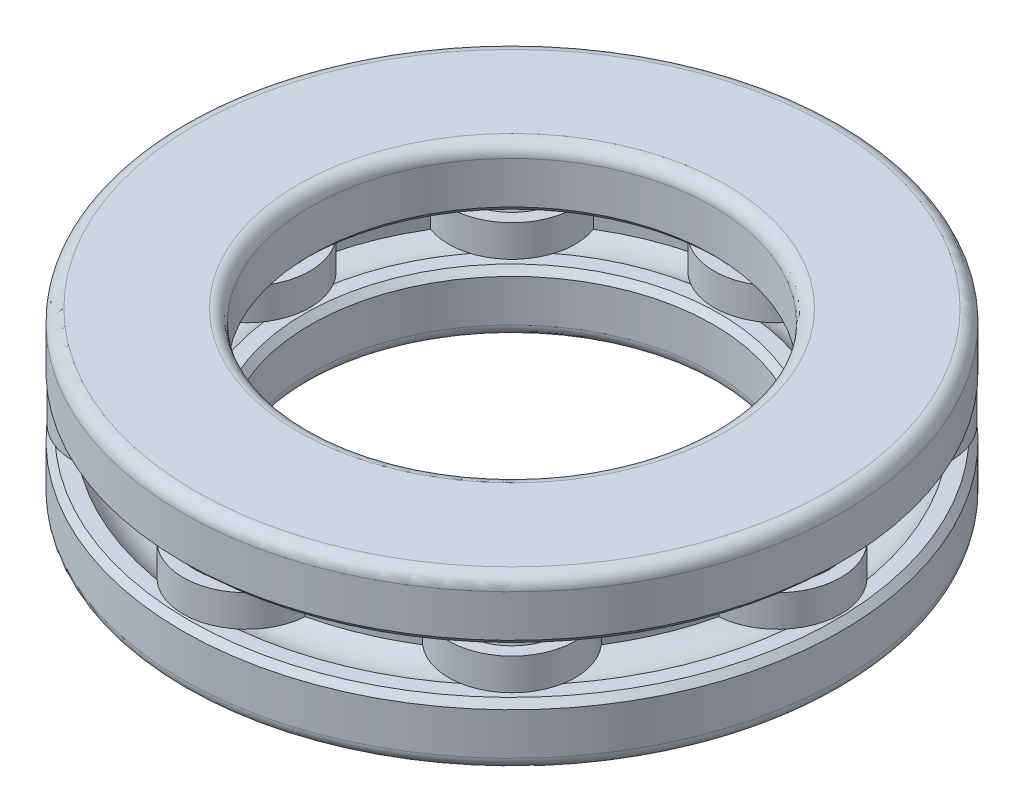
from build123d import *

# Parameters (mm, degrees)
CIRPATTERN2_COUNT       = 8
FILLET1_R               = 0.6
CHAMFER1_SIZE           = 0.6
FILLET2_R               = 0.6
CHAMFER2_SIZE           = 0.6
BOSS_EXTRUDE1_START     = -1
BOSS_EXTRUDE1_OUTLINE_R = 3.2
BOSS_EXTRUDE1_DEPTH     = 2
CUT_EXTRUDE1_DEPTH      = 31.20347676
CUT_EXTRUDE1_DEPTH_BACK = 31.20347676
SKETCH5_W               = 57.274889508
SKETCH5_H               = 8.854768194
SKETCH5_W_2             = 54.393576048
SKETCH5_H_2             = 6.043730672
SKETCH6_R               = 25.060722521
SKETCH6_R_2             = 20.796862697
SKETCH6_R_3             = 12.703137303
CUT_EXTRUDE2_DEPTH      = 32.56722991
FILLET3_R               = 0.8
FILLET4_R               = 0.8
FILLET5_R               = 0.8
FILLET6_R               = 0.8


# Read off the part's stored shape, not the designer's step: Boss-Extrude1
with BuildPart() as part:
    # Sketch1 → Revolve4 (revolve)
    with BuildSketch(Plane(origin=(0, 0, 0), x_dir=(0, 0, -1), z_dir=(1, 0, 0))):
        with BuildLine():
            Line((-16.75, 3), (-16.75, -3))
            ThreePointArc((-16.75, -3), (-19.75, 0), (-16.75, 3))
        make_face()
    revolve(axis=Axis((0, 0, 16.75), (0, 1, 0)))


with BuildPart() as body_2:
    # Sketch3 → Revolve5 (revolve)
    with BuildSketch(Plane(origin=(0, 0, 0), x_dir=(0, 0, -1), z_dir=(1, 0, 0)), mode=Mode.PRIVATE) as revolve5_sk:
        with BuildLine():
            Line((-12.5, 5.5), (-21, 5.5))
            Line((-21, 5.5), (-21, 1.5))
            Line((-21, 1.5), (-19.462931993, 1.5))
            ThreePointArc((-19.462931993, 1.5), (-16.75, 3.1), (-14.037068007, 1.5))
            Line((-14.037068007, 1.5), (-12.5, 1.5))
            Line((-12.5, 1.5), (-12.5, 5.5))
        make_face()
        with BuildLine():
            ThreePointArc((-14.037068007, -1.5), (-16.75, -3.1), (-19.462931993, -1.5))
            Line((-19.462931993, -1.5), (-21, -1.5))
            Line((-21, -1.5), (-21, -5.5))
            Line((-21, -5.5), (-12.5, -5.5))
            Line((-12.5, -5.5), (-12.5, -1.5))
            Line((-12.5, -1.5), (-14.037068007, -1.5))
        make_face()
    revolve(revolve5_sk.sketch.rotate(Axis((0, 0, 0), (0, 1, 0)), 180), axis=Axis((0, 0, 0), (0, 1, 0)))

    # Fillet1
    fillet1_edges = [body_2.edges().sort_by_distance(p)[0] for p in [
        (0, 5.5, 21),
        (0, 5.5, 12.5),
    ]]
    fillet(fillet1_edges, radius=FILLET1_R)

    # Chamfer1
    chamfer1_edges = [body_2.edges().sort_by_distance(p)[0] for p in [
        (0, -1.5, 12.5),
        (0, -1.5, 21),
    ]]
    chamfer(chamfer1_edges, length=CHAMFER1_SIZE)

    # Fillet2
    fillet2_edges = [body_2.edges().sort_by_distance(p)[0] for p in [
        (0, -5.5, 12.5),
        (0, -5.5, 21),
    ]]
    fillet(fillet2_edges, radius=FILLET2_R)

    # Chamfer2
    chamfer2_edges = [body_2.edges().sort_by_distance(p)[0] for p in [
        (0, 1.5, 21),
        (0, 1.5, 12.5),
    ]]
    chamfer(chamfer2_edges, length=CHAMFER2_SIZE)

    # Sketch5 → Cut-Extrude1 (cut, two sides: drawn at the far end of the back side and taken through both)
    with BuildSketch(Plane(origin=(0, 0, 0), x_dir=(0, 0, -1), z_dir=(1, 0, 0)).offset(-CUT_EXTRUDE1_DEPTH_BACK)):
        with Locations((2.600209708, 9.777384097)):
            Rectangle(SKETCH5_W, SKETCH5_H)
        with Locations((2.038002203, -8.371865336)):
            Rectangle(SKETCH5_W_2, SKETCH5_H_2)
    extrude(amount=CUT_EXTRUDE1_DEPTH + CUT_EXTRUDE1_DEPTH_BACK, mode=Mode.SUBTRACT)

    # Sketch6 → Cut-Extrude2 (cut, through all)
    # profile 1 of 2: a face of its own
    with BuildSketch(Plane(origin=(0, 5.35, 0), x_dir=(1, 0, 0), z_dir=(0, 1, 0))):
        Circle(SKETCH6_R)
        with Locations(Location((0, 0, 0), (0, 0, 270))):
            Circle(SKETCH6_R_2, mode=Mode.SUBTRACT)
    # profile 2 of 2: a face of its own
    with BuildSketch(Plane(origin=(0, 5.35, 0), x_dir=(1, 0, 0), z_dir=(0, 1, 0))):
        with Locations(Location((0, 0, 0), (0, 0, 270))):
            Circle(SKETCH6_R_3)
    extrude(amount=-CUT_EXTRUDE2_DEPTH, mode=Mode.SUBTRACT)

    # Fillet3
    fillet3_edges = [body_2.edges().sort_by_distance(p)[0] for p in [
        (0, 5.35, -20.796862697),
    ]]
    fillet(fillet3_edges, radius=FILLET3_R)

    # Fillet4
    fillet4_edges = [body_2.edges().sort_by_distance(p)[0] for p in [
        (0, -5.35, -20.796862697),
    ]]
    fillet(fillet4_edges, radius=FILLET4_R)

    # Fillet5
    fillet5_edges = [body_2.edges().sort_by_distance(p)[0] for p in [
        (0, 5.35, -12.703137303),
    ]]
    fillet(fillet5_edges, radius=FILLET5_R)

    # Fillet6
    fillet6_edges = [body_2.edges().sort_by_distance(p)[0] for p in [
        (0, -5.35, -12.703137303),
    ]]
    fillet(fillet6_edges, radius=FILLET6_R)


with BuildPart() as cirpattern2_1:
    # CirPattern2: pattern copy
    add(part.part.rotate(Axis((0, 0, 0), (0, 1, 0)), 1 * 360 / CIRPATTERN2_COUNT))


with BuildPart() as cirpattern2_2:
    # CirPattern2: pattern copy
    add(part.part.rotate(Axis((0, 0, 0), (0, 1, 0)), 2 * 360 / CIRPATTERN2_COUNT))


with BuildPart() as cirpattern2_3:
    # CirPattern2: pattern copy
    add(part.part.rotate(Axis((0, 0, 0), (0, 1, 0)), 3 * 360 / CIRPATTERN2_COUNT))


with BuildPart() as cirpattern2_4:
    # CirPattern2: pattern copy
    add(part.part.rotate(Axis((0, 0, 0), (0, 1, 0)), 4 * 360 / CIRPATTERN2_COUNT))


with BuildPart() as cirpattern2_5:
    # CirPattern2: pattern copy
    add(part.part.rotate(Axis((0, 0, 0), (0, 1, 0)), 5 * 360 / CIRPATTERN2_COUNT))


with BuildPart() as cirpattern2_6:
    # CirPattern2: pattern copy
    add(part.part.rotate(Axis((0, 0, 0), (0, 1, 0)), 6 * 360 / CIRPATTERN2_COUNT))


with BuildPart() as cirpattern2_7:
    # CirPattern2: pattern copy
    add(part.part.rotate(Axis((0, 0, 0), (0, 1, 0)), 7 * 360 / CIRPATTERN2_COUNT))


with BuildPart() as body_10:
    # Boss-Extrude1 outline → Boss-Extrude1 (new body)
    with BuildSketch(Plane(origin=(0, 0, 0), x_dir=(1, 0, 0), z_dir=(0, 1, 0)).offset(BOSS_EXTRUDE1_START)):
        with BuildLine():
            ThreePointArc((9.227493085, 14.869545096), (6.696960066, 16.167891819), (3.989533237, 17.039179104))
            ThreePointArc((3.989533237, 17.039179104), (0, 20.75), (-3.989533237, 17.039179104))
            ThreePointArc((-3.989533237, 17.039179104), (-6.696960066, 16.167891819), (-9.227493085, 14.869545096))
            ThreePointArc((-9.227493085, 14.869545096), (-14.67246571, 14.67246571), (-14.869545096, 9.227493085))
            ThreePointArc((-14.869545096, 9.227493085), (-16.167891819, 6.696960066), (-17.039179104, 3.989533237))
            ThreePointArc((-17.039179104, 3.989533237), (-20.75, 0), (-17.039179104, -3.989533237))
            ThreePointArc((-17.039179104, -3.989533237), (-16.167891819, -6.696960066), (-14.869545096, -9.227493085))
            ThreePointArc((-14.869545096, -9.227493085), (-14.67246571, -14.67246571), (-9.227493085, -14.869545096))
            ThreePointArc((-9.227493085, -14.869545096), (-6.696960066, -16.167891819), (-3.989533237, -17.039179104))
            ThreePointArc((-3.989533237, -17.039179104), (0, -20.75), (3.989533237, -17.039179104))
            ThreePointArc((3.989533237, -17.039179104), (6.696960066, -16.167891819), (9.227493085, -14.869545096))
            ThreePointArc((9.227493085, -14.869545096), (14.67246571, -14.67246571), (14.869545096, -9.227493085))
            ThreePointArc((14.869545096, -9.227493085), (16.167891819, -6.696960066), (17.039179104, -3.989533237))
            ThreePointArc((17.039179104, -3.989533237), (20.75, 0), (17.039179104, 3.989533237))
            ThreePointArc((17.039179104, 3.989533237), (16.167891819, 6.696960066), (14.869545096, 9.227493085))
            ThreePointArc((14.869545096, 9.227493085), (14.67246571, 14.67246571), (9.227493085, 14.869545096))
        make_face()
        with Locations((-11.844038585, -11.844038585)):
            Circle(BOSS_EXTRUDE1_OUTLINE_R, mode=Mode.SUBTRACT)
        with Locations((0, -16.75)):
            Circle(BOSS_EXTRUDE1_OUTLINE_R, mode=Mode.SUBTRACT)
        with Locations((11.844038585, -11.844038585)):
            Circle(BOSS_EXTRUDE1_OUTLINE_R, mode=Mode.SUBTRACT)
        with Locations((-16.75, 0)):
            Circle(BOSS_EXTRUDE1_OUTLINE_R, mode=Mode.SUBTRACT)
        with Locations((-11.844038585, 11.844038585)):
            Circle(BOSS_EXTRUDE1_OUTLINE_R, mode=Mode.SUBTRACT)
        with BuildLine():
            ThreePointArc((-8.08886499, 13.221961396), (-5.931593202, 14.320132754), (-3.629647277, 15.069029851))
            ThreePointArc((-3.629647277, 15.069029851), (0, 12.75), (3.629647277, 15.069029851))
            ThreePointArc((3.629647277, 15.069029851), (5.931593202, 14.320132754), (8.08886499, 13.221961396))
            ThreePointArc((8.08886499, 13.221961396), (9.01561146, 9.01561146), (13.221961396, 8.08886499))
            ThreePointArc((13.221961396, 8.08886499), (14.320132754, 5.931593202), (15.069029851, 3.629647277))
            ThreePointArc((15.069029851, 3.629647277), (12.75, 0), (15.069029851, -3.629647277))
            ThreePointArc((15.069029851, -3.629647277), (14.320132754, -5.931593202), (13.221961396, -8.08886499))
            ThreePointArc((13.221961396, -8.08886499), (9.01561146, -9.01561146), (8.08886499, -13.221961396))
            ThreePointArc((8.08886499, -13.221961396), (5.931593202, -14.320132754), (3.629647277, -15.069029851))
            ThreePointArc((3.629647277, -15.069029851), (0, -12.75), (-3.629647277, -15.069029851))
            ThreePointArc((-3.629647277, -15.069029851), (-5.931593202, -14.320132754), (-8.08886499, -13.221961396))
            ThreePointArc((-8.08886499, -13.221961396), (-9.01561146, -9.01561146), (-13.221961396, -8.08886499))
            ThreePointArc((-13.221961396, -8.08886499), (-14.320132754, -5.931593202), (-15.069029851, -3.629647277))
            ThreePointArc((-15.069029851, -3.629647277), (-12.75, 0), (-15.069029851, 3.629647277))
            ThreePointArc((-15.069029851, 3.629647277), (-14.320132754, 5.931593202), (-13.221961396, 8.08886499))
            ThreePointArc((-13.221961396, 8.08886499), (-9.01561146, 9.01561146), (-8.08886499, 13.221961396))
        make_face(mode=Mode.SUBTRACT)
        with Locations((16.75, 0)):
            Circle(BOSS_EXTRUDE1_OUTLINE_R, mode=Mode.SUBTRACT)
        with Locations((0, 16.75)):
            Circle(BOSS_EXTRUDE1_OUTLINE_R, mode=Mode.SUBTRACT)
        with Locations((11.844038585, 11.844038585)):
            Circle(BOSS_EXTRUDE1_OUTLINE_R, mode=Mode.SUBTRACT)
    extrude(amount=BOSS_EXTRUDE1_DEPTH)


solid = Compound([part.part, body_2.part, cirpattern2_1.part, cirpattern2_2.part, cirpattern2_3.part, cirpattern2_4.part, cirpattern2_5.part, cirpattern2_6.part, cirpattern2_7.part, body_10.part])
